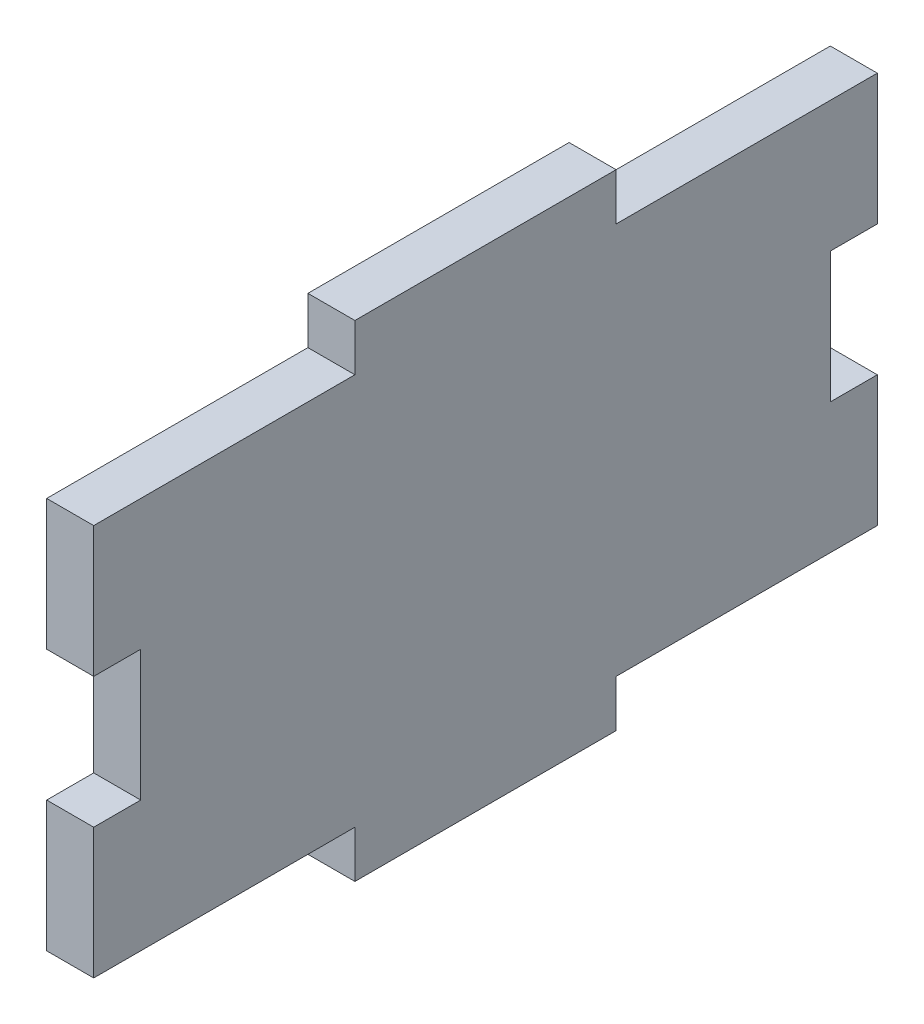
from build123d import *

# Parameters (mm, degrees)
SIDES_EXTRUDED_DEPTH = 3


with BuildPart() as part:
    # Sides → Sides Extruded (new body)
    with BuildSketch(Plane(origin=(0, 0, 0), x_dir=(0, 0, -1), z_dir=(1, 0, 0))):
        Polygon((0, 16.66666666), (0, 25), (16.666666667, 25), (16.666666667, 28), (33.333333333, 28), (33.333333333, 25), (50, 25), (50, 16.66666666), (47, 16.66666666), (47, 8.33333333), (50, 8.33333333), (50, 0), (33.333333333, 0), (33.333333333, -3), (16.666666667, -3), (16.666666667, 0), (0, 0), (0, 8.33333333), (3, 8.33333333), (3, 16.66666666), align=None)
    extrude(amount=SIDES_EXTRUDED_DEPTH)


solid = part.part
